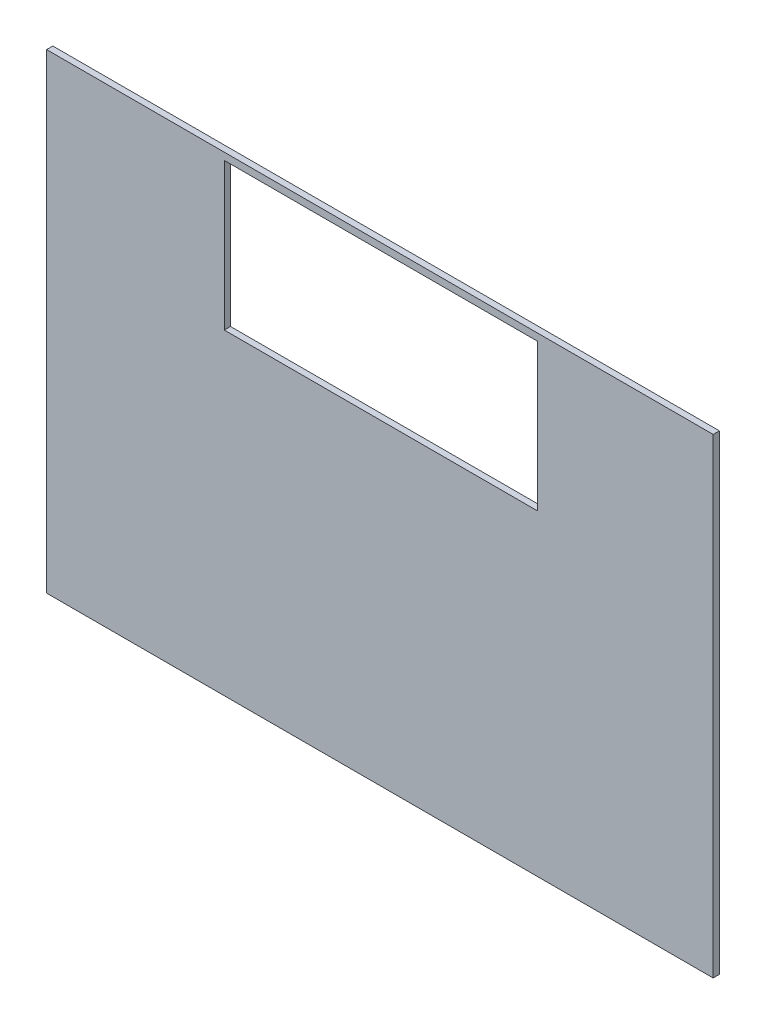
from build123d import *

# Parameters (mm, degrees)
SKETCH1_W           = 681.08
SKETCH1_H           = 481.00261168
BOSS_EXTRUDE1_DEPTH = 6.35
SKETCH2_W           = 319.846223413
SKETCH2_H           = 150.113551909
CUT_EXTRUDE1_DEPTH  = 10


with BuildPart() as part:
    # Sketch1 → Boss-Extrude1 (new body)
    with BuildSketch(Plane.XY):
        with Locations((340.54, -240.50130584)):
            Rectangle(SKETCH1_W, SKETCH1_H)
    extrude(amount=BOSS_EXTRUDE1_DEPTH)

    # Sketch2 → Cut-Extrude1 (cut)
    with BuildSketch(Plane(origin=(0, 0, 0), x_dir=(-1, 0, 0), z_dir=(0, 0, -1))):
        with Locations((-341.464956121, -82.352129436)):
            Rectangle(SKETCH2_W, SKETCH2_H)
    extrude(amount=-CUT_EXTRUDE1_DEPTH, mode=Mode.SUBTRACT)


solid = part.part
